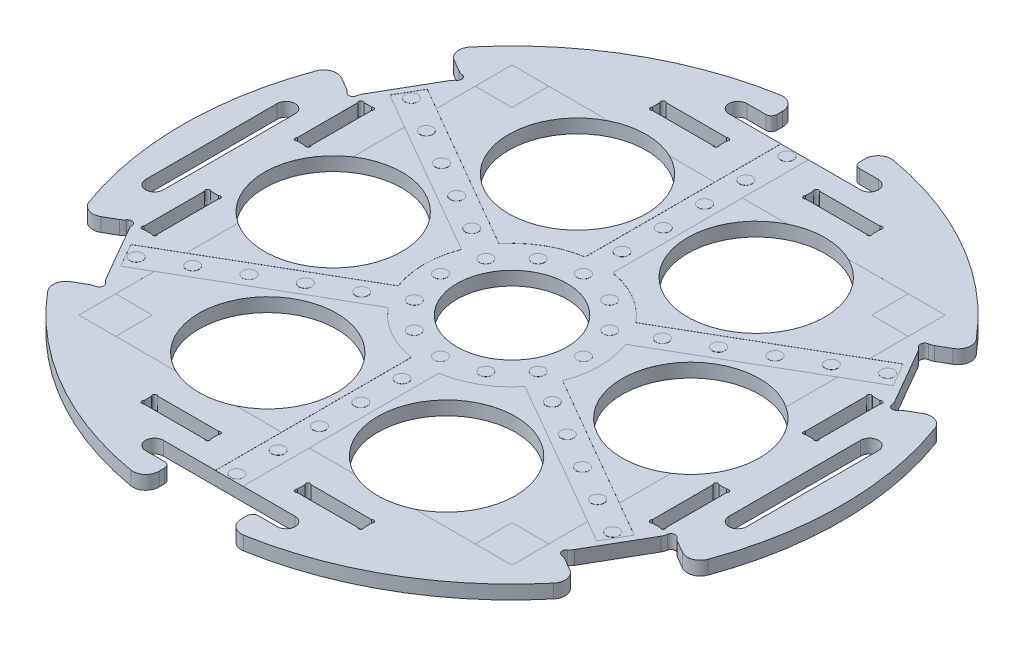
from build123d import *

# Parameters (mm, degrees)
SKETCH1_R                   = 76.099999946
BOSS_EXTRUDE1_DEPTH         = 3.175
SKETCH2_W                   = 19.05
SKETCH2_H                   = 9.424999946
BRACKETHOLE_DEPTH           = 108.668475463
SKETCH3_R                   = 1
DOGBONE_DEPTH               = 108.668475463
FILLET1_R                   = 3
CIRPATTERN1_COUNT           = 6
CIRPATTERN1_COPY_1_SKETCH_R = 1
CIRPATTERN1_COPY_1_DEPTH    = 108.668475463
CIRPATTERN1_COPY_2_SKETCH_R = 1
CIRPATTERN1_COPY_2_DEPTH    = 108.668475463
CIRPATTERN1_COPY_3_SKETCH_R = 1
CIRPATTERN1_COPY_3_DEPTH    = 108.668475463
CIRPATTERN1_COPY_4_SKETCH_R = 1
CIRPATTERN1_COPY_4_DEPTH    = 108.668475463
CIRPATTERN1_COPY_5_SKETCH_R = 1
CIRPATTERN1_COPY_5_DEPTH    = 108.668475463
FILLET1_OF_CIRPATTERN1_R    = 3
SKETCH5_W                   = 15.4
SKETCH5_H                   = 3.175
CUT_EXTRUDE3_DEPTH          = 107.90715084
SKETCH6_R                   = 0.5
CUT_EXTRUDE4_DEPTH          = 107.90715084
SKETCH_PATTERN1_DEPTH       = 3.175
CIRPATTERN2_COUNT           = 4
CIRPATTERN2_COPY_1_SKETCH_R = 0.5
CIRPATTERN2_COPY_1_DEPTH    = 107.90715084
CIRPATTERN2_COPY_2_SKETCH_R = 0.5
CIRPATTERN2_COPY_2_DEPTH    = 107.90715084
CIRPATTERN2_COPY_3_SKETCH_R = 0.5
CIRPATTERN2_COPY_3_DEPTH    = 107.90715084
CIRPATTERN2_COPY_4_DEPTH    = 3.175
CIRPATTERN2_COPY_5_DEPTH    = 3.175
CIRPATTERN2_COPY_6_DEPTH    = 3.175
CUT_EXTRUDE7_DEPTH          = 107.90715084
CUT_EXTRUDE7_DEPTH_BACK     = 107.90715084
SKETCH9_R                   = 12.7
SKETCH10_R                  = 15.875
CUT_EXTRUDE8_DEPTH          = 107.90715084
CIRPATTERN3_COUNT           = 6
CUT_EXTRUDE10_DEPTH         = 107.90715084
CIRPATTERN5_COUNT           = 4
FILLET2_R                   = 1.27
CUBESATFOOTPRINT_W          = 100
CUBESATFOOTPRINT_H          = 100
CUT_EXTRUDE5_DEPTH          = 0.0001
SKETCH8_W                   = 8.5
SKETCH8_H                   = 8.5
CUT_EXTRUDE6_DEPTH          = 0.0001
SKETCH12_R                  = 1.4732
CUT_EXTRUDE9_DEPTH          = 0.0254
CIRPATTERN4_COUNT           = 6


# Read off the part's stored shape, not the designer's step: Sketch-Pattern1
with BuildPart() as part:
    # Sketch1 → Boss-Extrude1 (new body)
    with BuildSketch(Plane(origin=(0, 0, 0), x_dir=(1, 0, 0), z_dir=(0, 1, 0))):
        with Locations(Location((0, 0, 0), (0, 0, 270))):
            Circle(SKETCH1_R)
    extrude(amount=BOSS_EXTRUDE1_DEPTH)

    # Sketch2 → bracketHole (cut, symmetric)
    with BuildSketch(Plane(origin=(0, 3.175, 0), x_dir=(1, 0, 0), z_dir=(0, 1, 0))):
        with Locations((0, 71.387499973)):
            Rectangle(SKETCH2_W, SKETCH2_H)
    brackethole = extrude(amount=BRACKETHOLE_DEPTH, both=True, mode=Mode.SUBTRACT)

    # Sketch3 → dogbone (cut, symmetric)
    with BuildSketch(Plane(origin=(0, 3.175, 0), x_dir=(1, 0, 0), z_dir=(0, 1, 0))):
        with Locations((-8.817893219, 67.382106781)):
            Circle(SKETCH3_R)
    dogbone = extrude(amount=DOGBONE_DEPTH, both=True, mode=Mode.SUBTRACT)

    # Mirror1: dogbone across plane
    add(dogbone.mirror(Plane(origin=(0, 0, 0), x_dir=(0, 0, 1), z_dir=(1, 0, 0))), mode=Mode.SUBTRACT)

    # Fillet1
    fillet1_edges = [part.edges().sort_by_distance(p)[0] for p in [
        (9.525, 1.5875, -75.501552082),
        (-9.525, 1.5875, -75.501552082),
        (-8.110786438, 1.5875, -66.675),
        (-9.525, 1.5875, -68.089213562),
        (8.110786438, 1.5875, -66.675),
        (9.525, 1.5875, -68.089213562),
    ]]
    fillet(fillet1_edges, radius=FILLET1_R)

    # CirPattern1: bracketHole, dogbone ×6 about axis
    cirpattern1_axis = Axis((0, 0, 0), (0, 1, 0))
    add([brackethole.rotate(cirpattern1_axis, i * 360 / CIRPATTERN1_COUNT) for i in range(1, CIRPATTERN1_COUNT)], mode=Mode.SUBTRACT)
    add([dogbone.rotate(cirpattern1_axis, i * 360 / CIRPATTERN1_COUNT) for i in range(1, CIRPATTERN1_COUNT)], mode=Mode.SUBTRACT)

    # CirPattern1 copy 1 sketch → CirPattern1 copy 1 (cut, symmetric)
    with BuildSketch(Plane(origin=(0, 3.175, 0), x_dir=(-0.5000000000000001, 0, 0.8660254037844386), z_dir=(0, 1, 0))):
        with Locations((-8.817893219, -67.382106781)):
            Circle(CIRPATTERN1_COPY_1_SKETCH_R)
    extrude(amount=CIRPATTERN1_COPY_1_DEPTH, both=True, mode=Mode.SUBTRACT)

    # CirPattern1 copy 2 sketch → CirPattern1 copy 2 (cut, symmetric)
    with BuildSketch(Plane(origin=(0, 3.175, 0), x_dir=(0.4999999999999998, 0, 0.8660254037844387), z_dir=(0, 1, 0))):
        with Locations((-8.817893219, -67.382106781)):
            Circle(CIRPATTERN1_COPY_2_SKETCH_R)
    extrude(amount=CIRPATTERN1_COPY_2_DEPTH, both=True, mode=Mode.SUBTRACT)

    # CirPattern1 copy 3 sketch → CirPattern1 copy 3 (cut, symmetric)
    with BuildSketch(Plane(origin=(0, 3.175, 0), x_dir=(1, 0, 0), z_dir=(0, 1, 0))):
        with Locations((-8.817893219, -67.382106781)):
            Circle(CIRPATTERN1_COPY_3_SKETCH_R)
    extrude(amount=CIRPATTERN1_COPY_3_DEPTH, both=True, mode=Mode.SUBTRACT)

    # CirPattern1 copy 4 sketch → CirPattern1 copy 4 (cut, symmetric)
    with BuildSketch(Plane(origin=(0, 3.175, 0), x_dir=(0.5000000000000004, 0, -0.8660254037844384), z_dir=(0, 1, 0))):
        with Locations((-8.817893219, -67.382106781)):
            Circle(CIRPATTERN1_COPY_4_SKETCH_R)
    extrude(amount=CIRPATTERN1_COPY_4_DEPTH, both=True, mode=Mode.SUBTRACT)

    # CirPattern1 copy 5 sketch → CirPattern1 copy 5 (cut, symmetric)
    with BuildSketch(Plane(origin=(0, 3.175, 0), x_dir=(-0.5000000000000001, 0, -0.8660254037844386), z_dir=(0, 1, 0))):
        with Locations((-8.817893219, -67.382106781)):
            Circle(CIRPATTERN1_COPY_5_SKETCH_R)
    extrude(amount=CIRPATTERN1_COPY_5_DEPTH, both=True, mode=Mode.SUBTRACT)

    # Fillet1 of CirPattern1
    fillet1_of_cirpattern1_edges = [part.edges().sort_by_distance(p)[0] for p in [
        (-60.623762128, 1.5875, -45.999668012),
        (-70.148762128, 1.5875, -29.50188407),
        (-61.797637016, 1.5875, -26.3133529),
        (-63.729488669, 1.5875, -25.79571481),
        (-53.686850579, 1.5875, -40.3616471),
        (-54.204488669, 1.5875, -42.293498752),
        (-70.148762128, 1.5875, 29.50188407),
        (-60.623762128, 1.5875, 45.999668012),
        (-53.686850579, 1.5875, 40.3616471),
        (-54.204488669, 1.5875, 42.293498752),
        (-61.797637016, 1.5875, 26.3133529),
        (-63.729488669, 1.5875, 25.79571481),
        (-9.525, 1.5875, 75.501552082),
        (9.525, 1.5875, 75.501552082),
        (8.110786438, 1.5875, 66.675),
        (9.525, 1.5875, 68.089213562),
        (-8.110786438, 1.5875, 66.675),
        (-9.525, 1.5875, 68.089213562),
        (60.623762128, 1.5875, 45.999668012),
        (70.148762128, 1.5875, 29.50188407),
        (61.797637016, 1.5875, 26.3133529),
        (63.729488669, 1.5875, 25.79571481),
        (53.686850579, 1.5875, 40.3616471),
        (54.204488669, 1.5875, 42.293498752),
        (70.148762128, 1.5875, -29.50188407),
        (60.623762128, 1.5875, -45.999668012),
        (53.686850579, 1.5875, -40.3616471),
        (54.204488669, 1.5875, -42.293498752),
        (61.797637016, 1.5875, -26.3133529),
        (63.729488669, 1.5875, -25.79571481),
    ]]
    fillet(fillet1_of_cirpattern1_edges, radius=FILLET1_OF_CIRPATTERN1_R)

    # Sketch5 → Cut-Extrude3 (cut, symmetric)
    with BuildSketch(Plane(origin=(0, 3.175, 0), x_dir=(1, 0, 0), z_dir=(0, 1, 0))):
        with Locations((17.7, 58.6875)):
            Rectangle(SKETCH5_W, SKETCH5_H)
        with Locations((-17.7, 58.6875)):
            Rectangle(SKETCH5_W, SKETCH5_H)
    cut_extrude3 = extrude(amount=CUT_EXTRUDE3_DEPTH, both=True, mode=Mode.SUBTRACT)

    # Sketch6 → Cut-Extrude4 (cut, symmetric)
    with BuildSketch(Plane(origin=(0, 3.175, 0), x_dir=(1, 0, 0), z_dir=(0, 1, 0))):
        with Locations((-25.046446609, 59.921446609)):
            Circle(SKETCH6_R)
        with Locations((-25.046446609, 57.453553391)):
            Circle(SKETCH6_R)
    cut_extrude4 = extrude(amount=CUT_EXTRUDE4_DEPTH, both=True, mode=Mode.SUBTRACT)

    # Sketch-Pattern1 outline → Sketch-Pattern1 (cut)
    with BuildSketch(Plane(origin=(0, 0, 0), x_dir=(1, 0, 0), z_dir=(0, 1, 0))):
        with BuildLine():
            Line((10, 60.275), (10.707106781, 60.275))
            ThreePointArc((10.707106781, 60.275), (10.353553391, 60.421446609), (10, 60.275))
        make_face()
        with BuildLine():
            Line((10.707106781, 57.1), (10, 57.1))
            ThreePointArc((10, 57.1), (10.353553391, 56.953553391), (10.707106781, 57.1))
        make_face()
        with BuildLine():
            Line((10, 57.1), (10, 57.807106781))
            ThreePointArc((10, 57.807106781), (9.853553391, 57.453553391), (10, 57.1))
        make_face()
        with BuildLine():
            Line((10, 59.567893219), (10, 60.275))
            ThreePointArc((10, 60.275), (9.853553391, 59.921446609), (10, 59.567893219))
        make_face()
    sketch_pattern1 = extrude(amount=SKETCH_PATTERN1_DEPTH, mode=Mode.SUBTRACT)

    # Mirror2: Cut-Extrude4, Sketch-Pattern1 across plane
    add(cut_extrude4.mirror(Plane(origin=(0, 0, 0), x_dir=(0, 0, 1), z_dir=(1, 0, 0))), mode=Mode.SUBTRACT)
    add(sketch_pattern1.mirror(Plane(origin=(0, 0, 0), x_dir=(0, 0, 1), z_dir=(1, 0, 0))), mode=Mode.SUBTRACT)

    # CirPattern2: Cut-Extrude3, Cut-Extrude4, Sketch-Pattern1 ×4 about axis
    cirpattern2_axis = Axis((0, 0, 0), (0, 1, 0))
    add([cut_extrude3.rotate(cirpattern2_axis, i * 360 / CIRPATTERN2_COUNT) for i in range(1, CIRPATTERN2_COUNT)], mode=Mode.SUBTRACT)
    add([cut_extrude4.rotate(cirpattern2_axis, i * 360 / CIRPATTERN2_COUNT) for i in range(1, CIRPATTERN2_COUNT)], mode=Mode.SUBTRACT)
    add([sketch_pattern1.rotate(cirpattern2_axis, i * 360 / CIRPATTERN2_COUNT) for i in range(1, CIRPATTERN2_COUNT)], mode=Mode.SUBTRACT)

    # CirPattern2 copy 1 sketch → CirPattern2 copy 1 (cut, symmetric)
    with BuildSketch(Plane.ZX.offset(3.175)):
        with Locations((-25.046446609, -59.921446609)):
            Circle(CIRPATTERN2_COPY_1_SKETCH_R)
        with Locations((-25.046446609, -57.453553391)):
            Circle(CIRPATTERN2_COPY_1_SKETCH_R)
    extrude(amount=CIRPATTERN2_COPY_1_DEPTH, both=True, mode=Mode.SUBTRACT)

    # CirPattern2 copy 2 sketch → CirPattern2 copy 2 (cut, symmetric)
    with BuildSketch(Plane(origin=(0, 3.175, 0), x_dir=(1, 0, 0), z_dir=(0, 1, 0))):
        with Locations((-25.046446609, -59.921446609)):
            Circle(CIRPATTERN2_COPY_2_SKETCH_R)
        with Locations((-25.046446609, -57.453553391)):
            Circle(CIRPATTERN2_COPY_2_SKETCH_R)
    extrude(amount=CIRPATTERN2_COPY_2_DEPTH, both=True, mode=Mode.SUBTRACT)

    # CirPattern2 copy 3 sketch → CirPattern2 copy 3 (cut, symmetric)
    with BuildSketch(Plane(origin=(0, 3.175, 0), x_dir=(0, 0, -1), z_dir=(0, 1, 0))):
        with Locations((-25.046446609, -59.921446609)):
            Circle(CIRPATTERN2_COPY_3_SKETCH_R)
        with Locations((-25.046446609, -57.453553391)):
            Circle(CIRPATTERN2_COPY_3_SKETCH_R)
    extrude(amount=CIRPATTERN2_COPY_3_DEPTH, both=True, mode=Mode.SUBTRACT)

    # CirPattern2 copy 4 sketch → CirPattern2 copy 4 (cut)
    with BuildSketch(Plane.ZX):
        with BuildLine():
            Line((10, -60.275), (10.707106781, -60.275))
            ThreePointArc((10.707106781, -60.275), (10.353553391, -60.421446609), (10, -60.275))
        make_face()
        with BuildLine():
            Line((10.707106781, -57.1), (10, -57.1))
            ThreePointArc((10, -57.1), (10.353553391, -56.953553391), (10.707106781, -57.1))
        make_face()
        with BuildLine():
            Line((10, -57.1), (10, -57.807106781))
            ThreePointArc((10, -57.807106781), (9.853553391, -57.453553391), (10, -57.1))
        make_face()
        with BuildLine():
            Line((10, -59.567893219), (10, -60.275))
            ThreePointArc((10, -60.275), (9.853553391, -59.921446609), (10, -59.567893219))
        make_face()
    extrude(amount=CIRPATTERN2_COPY_4_DEPTH, mode=Mode.SUBTRACT)

    # CirPattern2 copy 5 sketch → CirPattern2 copy 5 (cut)
    with BuildSketch(Plane(origin=(0, 0, 0), x_dir=(1, 0, 0), z_dir=(0, 1, 0))):
        with BuildLine():
            Line((10, -60.275), (10.707106781, -60.275))
            ThreePointArc((10.707106781, -60.275), (10.353553391, -60.421446609), (10, -60.275))
        make_face()
        with BuildLine():
            Line((10.707106781, -57.1), (10, -57.1))
            ThreePointArc((10, -57.1), (10.353553391, -56.953553391), (10.707106781, -57.1))
        make_face()
        with BuildLine():
            Line((10, -57.1), (10, -57.807106781))
            ThreePointArc((10, -57.807106781), (9.853553391, -57.453553391), (10, -57.1))
        make_face()
        with BuildLine():
            Line((10, -59.567893219), (10, -60.275))
            ThreePointArc((10, -60.275), (9.853553391, -59.921446609), (10, -59.567893219))
        make_face()
    extrude(amount=CIRPATTERN2_COPY_5_DEPTH, mode=Mode.SUBTRACT)

    # CirPattern2 copy 6 sketch → CirPattern2 copy 6 (cut)
    with BuildSketch(Plane(origin=(0, 0, 0), x_dir=(0, 0, -1), z_dir=(0, 1, 0))):
        with BuildLine():
            Line((10, -60.275), (10.707106781, -60.275))
            ThreePointArc((10.707106781, -60.275), (10.353553391, -60.421446609), (10, -60.275))
        make_face()
        with BuildLine():
            Line((10.707106781, -57.1), (10, -57.1))
            ThreePointArc((10, -57.1), (10.353553391, -56.953553391), (10.707106781, -57.1))
        make_face()
        with BuildLine():
            Line((10, -57.1), (10, -57.807106781))
            ThreePointArc((10, -57.807106781), (9.853553391, -57.453553391), (10, -57.1))
        make_face()
        with BuildLine():
            Line((10, -59.567893219), (10, -60.275))
            ThreePointArc((10, -60.275), (9.853553391, -59.921446609), (10, -59.567893219))
        make_face()
    extrude(amount=CIRPATTERN2_COPY_6_DEPTH, mode=Mode.SUBTRACT)

    # Sketch9 → Cut-Extrude7 (cut, two sides: drawn at the far end of the back side and taken through both)
    with BuildSketch(Plane(origin=(0, 3.175, 0), x_dir=(1, 0, 0), z_dir=(0, 1, 0)).offset(-CUT_EXTRUDE7_DEPTH_BACK)):
        with Locations(Location((0, 0, 0), (0, 0, 270))):
            Circle(SKETCH9_R)
    extrude(amount=CUT_EXTRUDE7_DEPTH + CUT_EXTRUDE7_DEPTH_BACK, mode=Mode.SUBTRACT)

    # Sketch10 → Cut-Extrude8 (cut, symmetric)
    with BuildSketch(Plane(origin=(0, 3.175, 0), x_dir=(1, 0, 0), z_dir=(0, 1, 0))):
        with Locations(Location((41.275, 0, 0), (0, 0, 270))):
            Circle(SKETCH10_R)
    cut_extrude8 = extrude(amount=CUT_EXTRUDE8_DEPTH, both=True, mode=Mode.SUBTRACT)

    # CirPattern3: Cut-Extrude8 ×6 about axis
    cirpattern3_axis = Axis((0, 0, 0), (0, 1, 0))
    for i in range(1, CIRPATTERN3_COUNT):
        add(cut_extrude8.rotate(cirpattern3_axis, i * 360 / CIRPATTERN3_COUNT), mode=Mode.SUBTRACT)

    # Sketch13 → Cut-Extrude10 (cut, symmetric)
    with BuildSketch(Plane(origin=(0, 3.175, 0), x_dir=(1, 0, 0), z_dir=(0, 1, 0))):
        with BuildLine():
            Line((69.40686906, 15.1954357), (69.40686906, -15.1954357))
            ThreePointArc((69.40686906, -15.1954357), (67.34093593, -17.26136883), (65.2750028, -15.1954357))
            Line((65.2750028, -15.1954357), (65.2750028, 15.1954357))
            ThreePointArc((65.2750028, 15.1954357), (67.34093593, 17.26136883), (69.40686906, 15.1954357))
        make_face()
    cut_extrude10 = extrude(amount=CUT_EXTRUDE10_DEPTH, both=True, mode=Mode.SUBTRACT)

    # CirPattern5: Cut-Extrude10 ×4 about axis
    cirpattern5_axis = Axis((0, 0, 0), (0, 1, 0))
    for i in range(1, CIRPATTERN5_COUNT):
        add(cut_extrude10.rotate(cirpattern5_axis, i * 360 / CIRPATTERN5_COUNT), mode=Mode.SUBTRACT)

    # Fillet2
    fillet2_edges = [part.edges().sort_by_distance(p)[0] for p in [
        (9.525, 1.5875, 69.40686906),
        (-9.525, 1.5875, 69.40686906),
        (-9.525, 1.5875, -69.40686906),
        (9.525, 1.5875, -69.40686906),
    ]]
    fillet(fillet2_edges, radius=FILLET2_R)

    # cubesatFootprint → Cut-Extrude5 (cut)
    with BuildSketch(Plane(origin=(0, 3.175, 0), x_dir=(1, 0, 0), z_dir=(0, 1, 0))):
        Rectangle(CUBESATFOOTPRINT_W, CUBESATFOOTPRINT_H)
    extrude(amount=-CUT_EXTRUDE5_DEPTH, mode=Mode.SUBTRACT)

    # Sketch8 → Cut-Extrude6 (cut)
    with BuildSketch(Plane(origin=(0, 3.1749, 0), x_dir=(1, 0, 0), z_dir=(0, 1, 0))):
        with Locations((-45.75, 45.75)):
            Rectangle(SKETCH8_W, SKETCH8_H)
        with Locations((45.75, 45.75)):
            Rectangle(SKETCH8_W, SKETCH8_H)
        with Locations((45.75, -45.75)):
            Rectangle(SKETCH8_W, SKETCH8_H)
        with Locations((-45.75, -45.75)):
            Rectangle(SKETCH8_W, SKETCH8_H)
    extrude(amount=-CUT_EXTRUDE6_DEPTH, mode=Mode.SUBTRACT)

    # Sketch12 → Cut-Extrude9 (cut)
    with BuildSketch(Plane(origin=(0, 3.175, 0), x_dir=(1, 0, 0), z_dir=(0, 1, 0))):
        with BuildLine():
            Line((-3.175, 65.2750028), (3.175, 65.2750028))
            Line((3.175, 65.2750028), (3.175, 20.070420399))
            ThreePointArc((3.175, 20.070420399), (8.424840004, 18.491199823), (13.061444229, 15.566023084))
            Line((13.061444229, 15.566023084), (0, 0))
            Line((0, 0), (-13.061444229, 15.566023084))
            ThreePointArc((-13.061444229, 15.566023084), (-8.424840004, 18.491199823), (-3.175, 20.070420399))
            Line((-3.175, 20.070420399), (-3.175, 65.2750028))
        make_face()
        with Locations(Location((0, 16.51, 0), (0, 0, 270))):
            Circle(SKETCH12_R, mode=Mode.SUBTRACT)
        with Locations(Location((0, 25.4, 0), (0, 0, 270))):
            Circle(SKETCH12_R, mode=Mode.SUBTRACT)
        with Locations(Location((0, 34.925, 0), (0, 0, 270))):
            Circle(SKETCH12_R, mode=Mode.SUBTRACT)
        with Locations(Location((0, 44.45, 0), (0, 0, 270))):
            Circle(SKETCH12_R, mode=Mode.SUBTRACT)
        with Locations(Location((0, 53.975, 0), (0, 0, 270))):
            Circle(SKETCH12_R, mode=Mode.SUBTRACT)
        with Locations(Location((-8.255, 14.298079416, 0), (0, 0, 270))):
            Circle(SKETCH12_R, mode=Mode.SUBTRACT)
        with Locations(Location((8.255, 14.298079416, 0), (0, 0, 270))):
            Circle(SKETCH12_R, mode=Mode.SUBTRACT)
        with Locations(Location((0, 63.5, 0), (0, 0, 270))):
            Circle(SKETCH12_R, mode=Mode.SUBTRACT)
    cut_extrude9 = extrude(amount=-CUT_EXTRUDE9_DEPTH, mode=Mode.SUBTRACT)

    # CirPattern4: Cut-Extrude9 ×6 about axis
    cirpattern4_axis = Axis((0, 0, 0), (0, 1, 0))
    for i in range(1, CIRPATTERN4_COUNT):
        add(cut_extrude9.rotate(cirpattern4_axis, i * 360 / CIRPATTERN4_COUNT), mode=Mode.SUBTRACT)


solid = part.part
